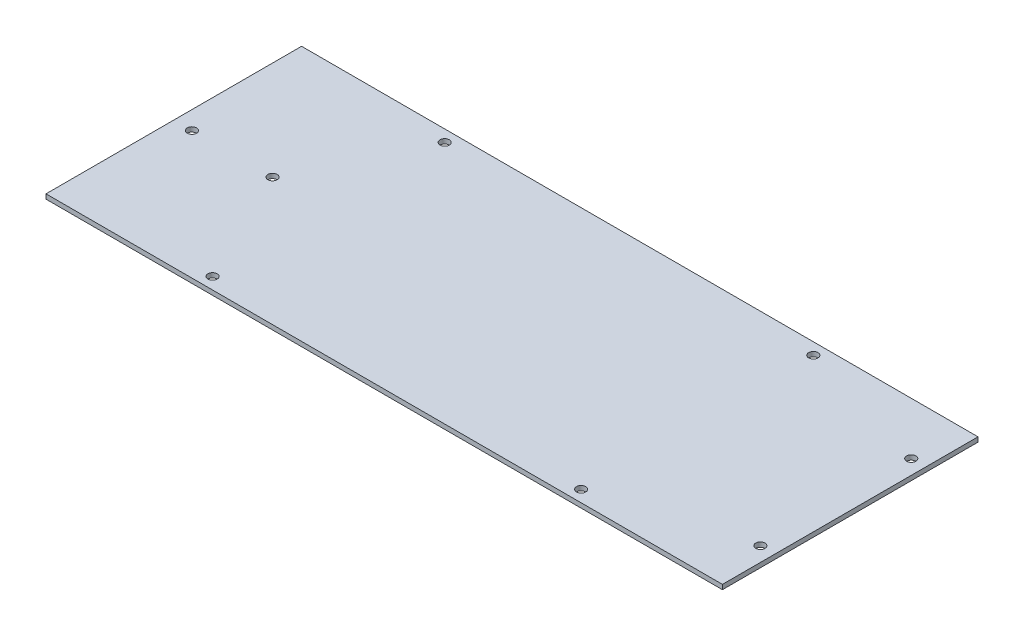
from build123d import *

# Parameters (mm, degrees)
SKETCH1_W           = 436.716939458
SKETCH1_H           = 165
SKETCH1_R           = 3
BOSS_EXTRUDE1_DEPTH = 3


with BuildPart() as part:
    # Sketch1 → Boss-Extrude1 (new body)
    with BuildSketch(Plane(origin=(0, 0, 0), x_dir=(1, 0, 0), z_dir=(0, 1, 0))):
        with Locations((605.569945171, -727.527587921)):
            Rectangle(SKETCH1_W, SKETCH1_H)
        with Locations((398.940381209, -727.527587921)):
            Circle(SKETCH1_R, mode=Mode.SUBTRACT)
        with Locations((450.99121253, -727.527587921)):
            Circle(SKETCH1_R, mode=Mode.SUBTRACT)
        with Locations((487.159305465, -802.457587921)):
            Circle(SKETCH1_R, mode=Mode.SUBTRACT)
        with Locations((725.159305465, -802.457587921)):
            Circle(SKETCH1_R, mode=Mode.SUBTRACT)
        with Locations((814.567305465, -776.18764025)):
            Circle(SKETCH1_R, mode=Mode.SUBTRACT)
        with Locations((814.567305465, -678.759587921)):
            Circle(SKETCH1_R, mode=Mode.SUBTRACT)
        with Locations((487.159305465, -652.597587921)):
            Circle(SKETCH1_R, mode=Mode.SUBTRACT)
        with Locations((725.159305465, -652.597587921)):
            Circle(SKETCH1_R, mode=Mode.SUBTRACT)
    extrude(amount=BOSS_EXTRUDE1_DEPTH)


solid = part.part
